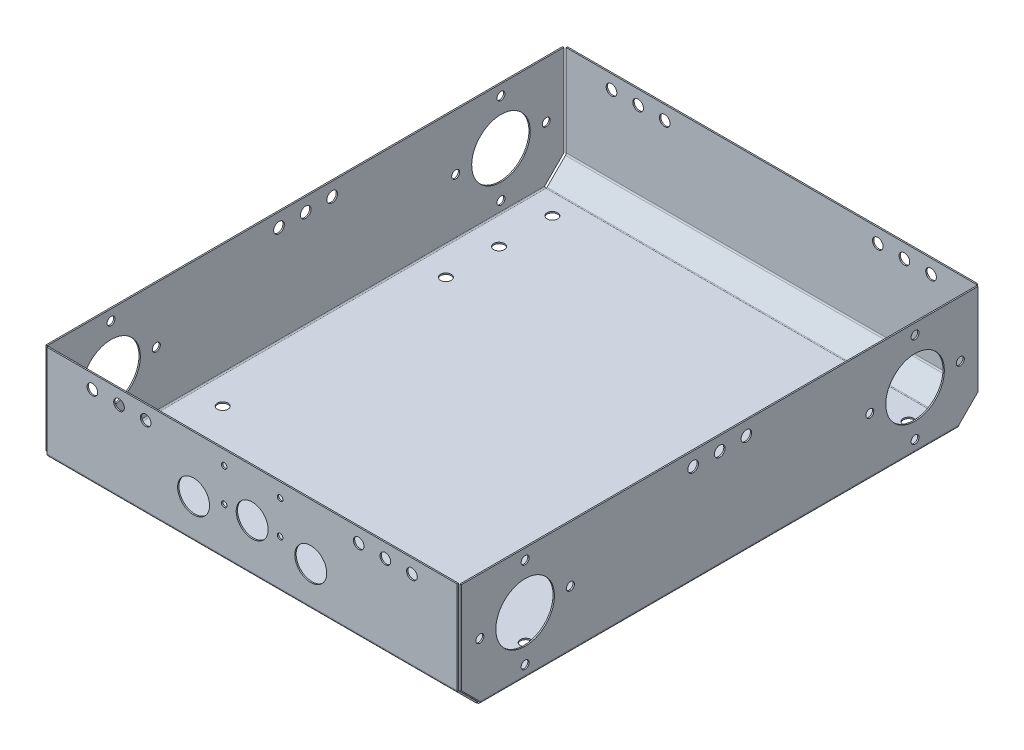
from build123d import *

# Parameters (mm, degrees)
SKETCH1_W                    = 155
SKETCH1_H                    = 180
BASE_FLANGE1_DEPTH           = 0.5
EDGE_FLANGE1_STRIP_W         = 3
EDGE_FLANGE1_STRIP_H         = 0.5
EDGE_FLANGE1_STRIP_CUT_DEPTH = 180
EDGE_FLANGE1_DEPTH           = 180
EDGE_FLANGE9_STRIP_W         = 3
EDGE_FLANGE9_STRIP_H         = 0.5
EDGE_FLANGE9_STRIP_CUT_DEPTH = 180
EDGE_FLANGE9_DEPTH           = 180
EDGE_FLANGE3_START           = -0.5
EDGE_FLANGE3_DEPTH           = 156
EDGE_FLANGE3_2_DEPTH         = 1
EDGE_FLANGE3_START_2         = 154.5
EDGE_FLANGE3_3_DEPTH         = 1
EDGE_FLANGE3_START_3         = 0.5
EDGE_FLANGE3_4_DEPTH         = 154
EDGE_FLANGE4_DEPTH           = 154
SKETCH25_W                   = 0.5
SKETCH25_H                   = 41.5
BOSS_EXTRUDE1_DEPTH          = 7
CUT_EXTRUDE2_DEPTH           = 0.5
EDGE_FLANGE5_STRIP_CUT_DEPTH = 154
EDGE_FLANGE5_DEPTH           = 154
EDGE_FLANGE6_STRIP_CUT_DEPTH = 154
EDGE_FLANGE6_DEPTH           = 154
SKETCH41_W                   = 0.5
SKETCH41_H                   = 41.5
BOSS_EXTRUDE2_DEPTH          = 7
CUT_EXTRUDE3_DEPTH           = 0.5
SKETCH45_R                   = 11
CUT_EXTRUDE6_DEPTH           = 2
SKETCH51_R                   = 1.5
CUT_EXTRUDE7_DEPTH           = 2
SKETCH61_W                   = 0.5
SKETCH61_H                   = 41.5
BOSS_EXTRUDE3_DEPTH          = 7
SKETCH62_W                   = 0.5
SKETCH62_H                   = 41.5
BOSS_EXTRUDE4_DEPTH          = 7
CUT_EXTRUDE8_DEPTH           = 0.5
CUT_EXTRUDE9_DEPTH           = 0.5
SKETCH65_R                   = 11
CUT_EXTRUDE10_DEPTH          = 0.5
SKETCH66_R                   = 1.5
CUT_EXTRUDE11_DEPTH          = 0.5
SKETCH67_R                   = 11
CUT_EXTRUDE12_DEPTH          = 0.5
SKETCH68_R                   = 1.5
CUT_EXTRUDE13_DEPTH          = 0.5
SKETCH69_R                   = 1.5
CUT_EXTRUDE14_DEPTH          = 0.5
SKETCH70_R                   = 2
CUT_EXTRUDE15_DEPTH          = 248.239065441
SKETCH75_R                   = 6
CUT_EXTRUDE16_DEPTH          = 10
SKETCH76_R                   = 1.05
CUT_EXTRUDE17_DEPTH          = 5
SKETCH77_R                   = 2
CUT_EXTRUDE18_DEPTH          = 5
CUT_EXTRUDE23_START          = 5
SKETCH78_R                   = 2
CUT_EXTRUDE23_DEPTH          = 5
SKETCH79_R                   = 2
CUT_EXTRUDE24_DEPTH          = 5
CUT_EXTRUDE25_START          = -5
SKETCH80_R                   = 2
CUT_EXTRUDE25_DEPTH          = 5
SKETCH81_R                   = 2
CUT_EXTRUDE26_DEPTH          = 5
SKETCH83_R                   = 2
CUT_EXTRUDE28_DEPTH          = 15
SKETCH84_R                   = 2
CUT_EXTRUDE29_DEPTH          = 5
CUT_EXTRUDE30_START          = -5
SKETCH85_R                   = 2
CUT_EXTRUDE30_DEPTH          = 5
SKETCH88_R                   = 6
CUT_EXTRUDE31_DEPTH          = 5


# Read off the part's stored shape, not the designer's step: Edge-Flange3
# Sheet-metal steps are written as plain solids
with BuildPart() as part:
    # Sketch1 → Base-Flange1 (new body)
    with BuildSketch(Plane(origin=(0, 0, 0), x_dir=(1, 0, 0), z_dir=(0, 1, 0))):
        with Locations((77.5, -90)):
            Rectangle(SKETCH1_W, SKETCH1_H)
    extrude(amount=-BASE_FLANGE1_DEPTH)

    # Edge-Flange1 strip (across the edge) → Edge-Flange1 strip cut (cut)
    with BuildSketch(Plane.XY):
        with Locations((-1, -0.25)):
            Rectangle(EDGE_FLANGE1_STRIP_W, EDGE_FLANGE1_STRIP_H)
    extrude(amount=EDGE_FLANGE1_STRIP_CUT_DEPTH, mode=Mode.SUBTRACT)

    # Edge-Flange1 section (across the edge) → Edge-Flange1 (add)
    with BuildSketch(Plane.XY):
        with BuildLine():
            Line((-0.5, 0.5), (-0.5, 42))
            Line((-0.5, 42), (0, 42))
            Line((0, 42), (0, 0.5))
            ThreePointArc((0, 0.5), (0.146446609, 0.146446609), (0.5, 0))
            Line((0.5, 0), (0.5, -0.5))
            ThreePointArc((0.5, -0.5), (-0.207106781, -0.207106781), (-0.5, 0.5))
        make_face()
    extrude(amount=EDGE_FLANGE1_DEPTH)

    # Edge-Flange9 strip (across the edge) → Edge-Flange9 strip cut (cut)
    with BuildSketch(Plane(origin=(155, 0, 180), x_dir=(-1, 0, 0), z_dir=(0, 0, -1))):
        with Locations((-1, -0.25)):
            Rectangle(EDGE_FLANGE9_STRIP_W, EDGE_FLANGE9_STRIP_H)
    extrude(amount=EDGE_FLANGE9_STRIP_CUT_DEPTH, mode=Mode.SUBTRACT)

    # Edge-Flange9 section (across the edge) → Edge-Flange9 (add)
    with BuildSketch(Plane(origin=(155, 0, 180), x_dir=(-1, 0, 0), z_dir=(0, 0, -1))):
        with BuildLine():
            Line((-0.5, 0.5), (-0.5, 42))
            Line((-0.5, 42), (0, 42))
            Line((0, 42), (0, 0.5))
            ThreePointArc((0, 0.5), (0.146446609, 0.146446609), (0.5, 0))
            Line((0.5, 0), (0.5, -0.5))
            ThreePointArc((0.5, -0.5), (-0.207106781, -0.207106781), (-0.5, 0.5))
        make_face()
    extrude(amount=EDGE_FLANGE9_DEPTH)

    # Edge-Flange3 outline → Edge-Flange3 (cut)
    with BuildSketch(Plane.YZ.offset(EDGE_FLANGE3_START)):
        with BuildLine():
            Line((0.5, 0), (0.5, 0.207106781))
            Line((0.5, 0.207106781), (0, 0.207106781))
            ThreePointArc((0, 0.207106781), (0.011356505, 0.101146719), (0.04491014, 0))
            Line((0.04491014, 0), (0.5, 0))
        make_face()
        with BuildLine():
            ThreePointArc((-0.478318344, 0), (-0.494564815, 0.102987483), (-0.5, 0.207106781))
            Line((-0.5, 0.207106781), (-0.5, 0))
            Line((-0.5, 0), (-0.478318344, 0))
        make_face()
    extrude(amount=EDGE_FLANGE3_DEPTH, mode=Mode.SUBTRACT)

    # Edge-Flange3 2 outline → Edge-Flange3 2 (cut)
    with BuildSketch(Plane.YZ.offset(EDGE_FLANGE3_START)):
        with BuildLine():
            Line((-0.478318344, 0), (0.04491014, 0))
            ThreePointArc((0.04491014, 0), (0.011356505, 0.101146719), (0, 0.207106781))
            Line((0, 0.207106781), (-0.5, 0.207106781))
            ThreePointArc((-0.5, 0.207106781), (-0.494564815, 0.102987483), (-0.478318344, 0))
        make_face()
    extrude(amount=EDGE_FLANGE3_2_DEPTH, mode=Mode.SUBTRACT)

    # Edge-Flange3 3 outline → Edge-Flange3 3 (cut)
    with BuildSketch(Plane.YZ.offset(EDGE_FLANGE3_START_2)):
        with BuildLine():
            Line((-0.478318344, 0), (0.04491014, 0))
            ThreePointArc((0.04491014, 0), (0.011356505, 0.101146719), (0, 0.207106781))
            Line((0, 0.207106781), (-0.5, 0.207106781))
            ThreePointArc((-0.5, 0.207106781), (-0.494564815, 0.102987483), (-0.478318344, 0))
        make_face()
    extrude(amount=EDGE_FLANGE3_3_DEPTH, mode=Mode.SUBTRACT)

    # Edge-Flange3 4 outline → Edge-Flange3 4 (add)
    with BuildSketch(Plane.YZ.offset(EDGE_FLANGE3_START_3)):
        with BuildLine():
            Line((0, 0.207106781), (0, 0))
            Line((0, 0), (-0.478318344, 0))
            ThreePointArc((-0.478318344, 0), (-0.379013346, -0.269690385), (-0.207106781, -0.5))
            Line((-0.207106781, -0.5), (6.717514421, -7.424621202))
            Line((6.717514421, -7.424621202), (7.071067812, -7.071067812))
            Line((7.071067812, -7.071067812), (0.146446609, -0.146446609))
            ThreePointArc((0.146446609, -0.146446609), (0.038060234, 0.015765065), (0, 0.207106781))
        make_face()
    extrude(amount=EDGE_FLANGE3_4_DEPTH)

    # Edge-Flange4 section (across the edge) → Edge-Flange4 (add)
    with BuildSketch(Plane(origin=(154.5, 7.363961031, -7.363961031), x_dir=(0, 0, 1), z_dir=(-1, 0, 0))):
        with BuildLine():
            Line((-0.5, 0.414213562), (-0.5, 34.636038969))
            Line((-0.5, 34.636038969), (0, 34.636038969))
            Line((0, 34.636038969), (0, 0.414213562))
            ThreePointArc((0, 0.414213562), (0.076120467, 0.03153013), (0.292893219, -0.292893219))
            Line((0.292893219, -0.292893219), (-0.060660172, -0.646446609))
            ThreePointArc((-0.060660172, -0.646446609), (-0.385819299, -0.159811586), (-0.5, 0.414213562))
        make_face()
    extrude(amount=EDGE_FLANGE4_DEPTH)

    # Sketch25 → Boss-Extrude1 (add)
    with BuildSketch(Plane(origin=(0, 0, 0), x_dir=(-1, 0, 0), z_dir=(0, 0, -1))):
        with Locations((0.25, 21.25)):
            Rectangle(SKETCH25_W, SKETCH25_H)
    extrude(amount=BOSS_EXTRUDE1_DEPTH)

    # Sketch28 → Cut-Extrude2 (cut)
    with BuildSketch(Plane.ZY.offset(0.5)):
        Polygon((-7.329886857, 8.036993638), (0.207106781, 0.5), (-7.329886857, 0.5), align=None)
    extrude(amount=-CUT_EXTRUDE2_DEPTH, mode=Mode.SUBTRACT)

    # Edge-Flange5 strip (across the edge) → Edge-Flange5 strip cut (cut)
    with BuildSketch(Plane(origin=(0.5, 0, 180), x_dir=(0, 0.7071067811865512, -0.7071067811865438), z_dir=(1, 0, 0))):
        Polygon((-2.328427125, 1.621320344), (-0.207106781, -0.5), (0.146446609, -0.146446609), (-1.974873734, 1.974873734), align=None)
    extrude(amount=EDGE_FLANGE5_STRIP_CUT_DEPTH, mode=Mode.SUBTRACT)

    # Edge-Flange5 section (across the edge) → Edge-Flange5 (add)
    with BuildSketch(Plane(origin=(0.5, 0, 180), x_dir=(0, 0.7071067811865512, -0.7071067811865438), z_dir=(1, 0, 0))):
        with BuildLine():
            Line((-0.5, 0.207106781), (-0.5, 10))
            Line((-0.5, 10), (0, 10))
            Line((0, 10), (0, 0.207106781))
            ThreePointArc((0, 0.207106781), (0.038060234, 0.015765065), (0.146446609, -0.146446609))
            Line((0.146446609, -0.146446609), (-0.207106781, -0.5))
            ThreePointArc((-0.207106781, -0.5), (-0.423879533, -0.175576651), (-0.5, 0.207106781))
        make_face()
    extrude(amount=EDGE_FLANGE5_DEPTH)

    # Edge-Flange6 strip (across the edge) → Edge-Flange6 strip cut (cut)
    with BuildSketch(Plane(origin=(0.5, 7.071067812, 187.071067812), x_dir=(0, 0, -1), z_dir=(1, 0, 0))):
        Polygon((-2.328427125, 1.621320344), (-0.207106781, -0.5), (0.146446609, -0.146446609), (-1.974873734, 1.974873734), align=None)
    extrude(amount=EDGE_FLANGE6_STRIP_CUT_DEPTH, mode=Mode.SUBTRACT)

    # Edge-Flange6 section (across the edge) → Edge-Flange6 (add)
    with BuildSketch(Plane(origin=(0.5, 7.071067812, 187.071067812), x_dir=(0, 0, -1), z_dir=(1, 0, 0))):
        with BuildLine():
            Line((-0.5, 0.207106781), (-0.5, 34.928932188))
            Line((-0.5, 34.928932188), (0, 34.928932188))
            Line((0, 34.928932188), (0, 0.207106781))
            ThreePointArc((0, 0.207106781), (0.038060234, 0.015765065), (0.146446609, -0.146446609))
            Line((0.146446609, -0.146446609), (-0.207106781, -0.5))
            ThreePointArc((-0.207106781, -0.5), (-0.423879533, -0.175576651), (-0.5, 0.207106781))
        make_face()
    extrude(amount=EDGE_FLANGE6_DEPTH)

    # Sketch41 → Boss-Extrude2 (add)
    with BuildSketch(Plane.XY.offset(180)):
        with Locations((-0.25, 21.25)):
            Rectangle(SKETCH41_W, SKETCH41_H)
    extrude(amount=BOSS_EXTRUDE2_DEPTH)

    # Sketch44 → Cut-Extrude3 (cut)
    with BuildSketch(Plane.ZY.offset(0.5)):
        Polygon((180, 0.5), (187, 7.5), (187, 0.5), align=None)
    extrude(amount=-CUT_EXTRUDE3_DEPTH, mode=Mode.SUBTRACT)

    # Sketch45 → Cut-Extrude6 (cut)
    with BuildSketch(Plane.ZY.offset(0.5)):
        with Locations(Location((16.636038969, 21, 0), (0, 0, 270))):
            Circle(SKETCH45_R)
        with Locations(Location((163.071067812, 21, 0), (0, 0, 270))):
            Circle(SKETCH45_R)
    extrude(amount=-CUT_EXTRUDE6_DEPTH, mode=Mode.SUBTRACT)

    # Sketch51 → Cut-Extrude7 (cut)
    with BuildSketch(Plane.ZY.offset(0.5)):
        with Locations(Location((16.636038969, 38, 0), (0, 0, 270))):
            Circle(SKETCH51_R)
        with Locations(Location((33.636038969, 21, 0), (0, 0, 270))):
            Circle(SKETCH51_R)
        with Locations(Location((16.636038969, 4, 0), (0, 0, 270))):
            Circle(SKETCH51_R)
        with Locations(Location((-0.363961031, 21, 0), (0, 0, 270))):
            Circle(SKETCH51_R)
    extrude(amount=-CUT_EXTRUDE7_DEPTH, mode=Mode.SUBTRACT)

    # Sketch61 → Boss-Extrude3 (add)
    with BuildSketch(Plane(origin=(0, 0, 0), x_dir=(-1, 0, 0), z_dir=(0, 0, -1))):
        with Locations((-155.25, 21.25)):
            Rectangle(SKETCH61_W, SKETCH61_H)
    extrude(amount=BOSS_EXTRUDE3_DEPTH)

    # Sketch62 → Boss-Extrude4 (add)
    with BuildSketch(Plane.XY.offset(180)):
        with Locations((155.25, 21.25)):
            Rectangle(SKETCH62_W, SKETCH62_H)
    extrude(amount=BOSS_EXTRUDE4_DEPTH)

    # Sketch63 → Cut-Extrude8 (cut)
    with BuildSketch(Plane(origin=(155.5, 0, 0), x_dir=(0, 0, -1), z_dir=(1, 0, 0))):
        Polygon((-0.207106781, 0.5), (7, 7.707106781), (7, 0.5), align=None)
    extrude(amount=-CUT_EXTRUDE8_DEPTH, mode=Mode.SUBTRACT)

    # Sketch64 → Cut-Extrude9 (cut)
    with BuildSketch(Plane(origin=(155.5, 0, 0), x_dir=(0, 0, -1), z_dir=(1, 0, 0))):
        Polygon((-180, 0.5), (-187, 7.5), (-187, 0.5), align=None)
    extrude(amount=-CUT_EXTRUDE9_DEPTH, mode=Mode.SUBTRACT)

    # Sketch65 → Cut-Extrude10 (cut)
    with BuildSketch(Plane.ZY.offset(-155)):
        with Locations(Location((16.636038969, 21, 0), (0, 0, 270))):
            Circle(SKETCH65_R)
    extrude(amount=-CUT_EXTRUDE10_DEPTH, mode=Mode.SUBTRACT)

    # Sketch66 → Cut-Extrude11 (cut)
    with BuildSketch(Plane.ZY.offset(-155)):
        with Locations(Location((16.636038969, 38, 0), (0, 0, 270))):
            Circle(SKETCH66_R)
        with Locations(Location((33.636038969, 21, 0), (0, 0, 270))):
            Circle(SKETCH66_R)
        with Locations(Location((16.636038969, 4, 0), (0, 0, 270))):
            Circle(SKETCH66_R)
        with Locations(Location((-0.363961031, 21, 0), (0, 0, 270))):
            Circle(SKETCH66_R)
    extrude(amount=-CUT_EXTRUDE11_DEPTH, mode=Mode.SUBTRACT)

    # Sketch67 → Cut-Extrude12 (cut)
    with BuildSketch(Plane.ZY.offset(-155)):
        with Locations(Location((163.071067812, 21, 0), (0, 0, 270))):
            Circle(SKETCH67_R)
    extrude(amount=-CUT_EXTRUDE12_DEPTH, mode=Mode.SUBTRACT)

    # Sketch68 → Cut-Extrude13 (cut)
    with BuildSketch(Plane.ZY.offset(0.5)):
        with Locations(Location((163.071067812, 38, 0), (0, 0, 270))):
            Circle(SKETCH68_R)
        with Locations(Location((180.071067812, 21, 0), (0, 0, 270))):
            Circle(SKETCH68_R)
        with Locations(Location((163.071067812, 4, 0), (0, 0, 270))):
            Circle(SKETCH68_R)
        with Locations(Location((146.071067812, 21, 0), (0, 0, 270))):
            Circle(SKETCH68_R)
    extrude(amount=-CUT_EXTRUDE13_DEPTH, mode=Mode.SUBTRACT)

    # Sketch69 → Cut-Extrude14 (cut)
    with BuildSketch(Plane.ZY.offset(-155)):
        with Locations(Location((163.071067812, 38, 0), (0, 0, 270))):
            Circle(SKETCH69_R)
        with Locations(Location((180.071067812, 21, 0), (0, 0, 270))):
            Circle(SKETCH69_R)
        with Locations(Location((163.071067812, 4, 0), (0, 0, 270))):
            Circle(SKETCH69_R)
        with Locations(Location((146.071067812, 21, 0), (0, 0, 270))):
            Circle(SKETCH69_R)
    extrude(amount=-CUT_EXTRUDE14_DEPTH, mode=Mode.SUBTRACT)

    # Sketch70 → Cut-Extrude15 (cut, through all)
    with BuildSketch(Plane(origin=(0, 0, 0), x_dir=(1, 0, 0), z_dir=(0, 1, 0))):
        with Locations(Location((144.38705, -7.956038969, 0), (0, 0, 270))):
            Circle(SKETCH70_R)
        with Locations(Location((144.38705, -27.956038969, 0), (0, 0, 270))):
            Circle(SKETCH70_R)
        with Locations(Location((144.38705, -47.956038969, 0), (0, 0, 270))):
            Circle(SKETCH70_R)
        with Locations(Location((144.38705, -131.751067812, 0), (0, 0, 270))):
            Circle(SKETCH70_R)
        with Locations(Location((144.38705, -151.751067812, 0), (0, 0, 270))):
            Circle(SKETCH70_R)
        with Locations(Location((144.38705, -171.751067812, 0), (0, 0, 270))):
            Circle(SKETCH70_R)
        with Locations(Location((10.61295, -171.751067812, 0), (0, 0, 270))):
            Circle(SKETCH70_R)
        with Locations(Location((10.61295, -151.751067812, 0), (0, 0, 270))):
            Circle(SKETCH70_R)
        with Locations(Location((10.61295, -131.751067812, 0), (0, 0, 270))):
            Circle(SKETCH70_R)
        with Locations(Location((10.61295, -7.956038969, 0), (0, 0, 270))):
            Circle(SKETCH70_R)
        with Locations(Location((10.61295, -27.956038969, 0), (0, 0, 270))):
            Circle(SKETCH70_R)
        with Locations(Location((10.61295, -47.956038969, 0), (0, 0, 270))):
            Circle(SKETCH70_R)
    extrude(amount=-CUT_EXTRUDE15_DEPTH, mode=Mode.SUBTRACT)

    # Sketch75 → Cut-Extrude16 (cut)
    with BuildSketch(Plane.XY.offset(187.571067812)):
        with Locations((77.5, 24.187428233)):
            Circle(SKETCH75_R)
    extrude(amount=-CUT_EXTRUDE16_DEPTH, mode=Mode.SUBTRACT)

    # Sketch76 → Cut-Extrude17 (cut)
    with BuildSketch(Plane(origin=(0, 0, 187.071067812), x_dir=(-1, 0, 0), z_dir=(0, 0, -1))):
        with Locations(Location((-88, 36.687428233, 0), (0, 0, 90))):
            Circle(SKETCH76_R)
        with Locations(Location((-88, 24.187428233, 0), (0, 0, 90))):
            Circle(SKETCH76_R)
        with Locations(Location((-67, 36.687428233, 0), (0, 0, 90))):
            Circle(SKETCH76_R)
        with Locations(Location((-67, 24.187428233, 0), (0, 0, 90))):
            Circle(SKETCH76_R)
    extrude(amount=-CUT_EXTRUDE17_DEPTH, mode=Mode.SUBTRACT)

    # Sketch77 → Cut-Extrude18 (cut)
    with BuildSketch(Plane.XY.offset(187.571067812)):
        with Locations((27.5, 36.75)):
            Circle(SKETCH77_R)
        with Locations((127.5, 36.75)):
            Circle(SKETCH77_R)
    extrude(amount=-CUT_EXTRUDE18_DEPTH, mode=Mode.SUBTRACT)

    # Sketch78 → Cut-Extrude23 (cut)
    with BuildSketch(Plane.XY.offset(-7.863961031).offset(CUT_EXTRUDE23_START)):
        with Locations((27.5, 36.75)):
            Circle(SKETCH78_R)
        with Locations((127.5, 36.75)):
            Circle(SKETCH78_R)
    extrude(amount=-CUT_EXTRUDE23_DEPTH, mode=Mode.SUBTRACT)

    # Sketch79 → Cut-Extrude24 (cut)
    with BuildSketch(Plane(origin=(155.5, 0, 0), x_dir=(0, 0, -1), z_dir=(1, 0, 0))):
        with Locations(Location((-89.967923987, 36.881858425, 0), (0, 0, 90))):
            Circle(SKETCH79_R)
    extrude(amount=-CUT_EXTRUDE24_DEPTH, mode=Mode.SUBTRACT)

    # Sketch80 → Cut-Extrude25 (cut)
    with BuildSketch(Plane.ZY.offset(0.5).offset(CUT_EXTRUDE25_START)):
        with Locations(Location((89.967923987, 36.881858425, 0), (0, 0, 90))):
            Circle(SKETCH80_R)
    extrude(amount=CUT_EXTRUDE25_DEPTH, mode=Mode.SUBTRACT)

    # Sketch81 → Cut-Extrude26 (cut)
    with BuildSketch(Plane(origin=(155.5, 0, 0), x_dir=(0, 0, -1), z_dir=(1, 0, 0))):
        with Locations(Location((-99.967923987, 36.881858425, 0), (0, 0, 90))):
            Circle(SKETCH81_R)
        with Locations(Location((-79.967923987, 36.881858425, 0), (0, 0, 90))):
            Circle(SKETCH81_R)
    extrude(amount=-CUT_EXTRUDE26_DEPTH, mode=Mode.SUBTRACT)

    # Sketch83 → Cut-Extrude28 (cut)
    with BuildSketch(Plane.ZY.offset(0.5)):
        with Locations(Location((79.997923987, 36.881858425, 0), (0, 0, 270))):
            Circle(SKETCH83_R)
        with Locations(Location((99.997923987, 36.881858425, 0), (0, 0, 270))):
            Circle(SKETCH83_R)
    extrude(amount=-CUT_EXTRUDE28_DEPTH, mode=Mode.SUBTRACT)

    # Sketch84 → Cut-Extrude29 (cut)
    with BuildSketch(Plane.XY.offset(187.571067812)):
        with Locations((17.5, 36.75)):
            Circle(SKETCH84_R)
        with Locations((37.5, 36.75)):
            Circle(SKETCH84_R)
        with Locations((117.5, 36.75)):
            Circle(SKETCH84_R)
        with Locations((137.5, 36.75)):
            Circle(SKETCH84_R)
    extrude(amount=-CUT_EXTRUDE29_DEPTH, mode=Mode.SUBTRACT)

    # Sketch85 → Cut-Extrude30 (cut)
    with BuildSketch(Plane(origin=(0, 0, -7.863961031), x_dir=(-1, 0, 0), z_dir=(0, 0, -1)).offset(CUT_EXTRUDE30_START)):
        with Locations(Location((-137.5, 36.75, 0), (0, 0, 180))):
            Circle(SKETCH85_R)
        with Locations(Location((-117.5, 36.75, 0), (0, 0, 180))):
            Circle(SKETCH85_R)
        with Locations(Location((-37.5, 36.75, 0), (0, 0, 180))):
            Circle(SKETCH85_R)
        with Locations(Location((-17.5, 36.75, 0), (0, 0, 180))):
            Circle(SKETCH85_R)
    extrude(amount=CUT_EXTRUDE30_DEPTH, mode=Mode.SUBTRACT)

    # Sketch88 → Cut-Extrude31 (cut)
    with BuildSketch(Plane.XY.offset(187.571067812)):
        with Locations((55.5, 21)):
            Circle(SKETCH88_R)
        with Locations((99.5, 21)):
            Circle(SKETCH88_R)
    extrude(amount=-CUT_EXTRUDE31_DEPTH, mode=Mode.SUBTRACT)


solid = part.part
